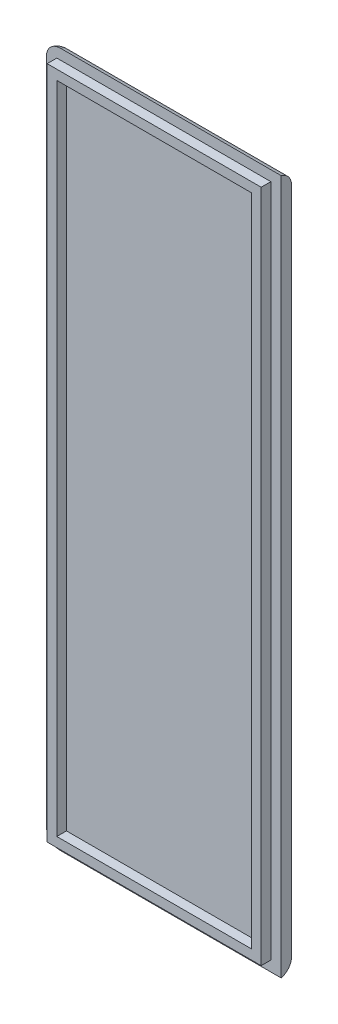
from build123d import *

# Parameters (mm, degrees)
ESQUISSE1_W        = 34
ESQUISSE1_H        = 100.65
BOSS_EXTRU_1_DEPTH = 1.5
ESQUISSE2_W        = 31
ESQUISSE2_H        = 97.65
ESQUISSE2_W_2      = 28.2
ESQUISSE2_H_2      = 94.85
BOSS_EXTRU_2_DEPTH = 1.4
CONG_6_R           = 2
CONG_8_R           = 2
CONG_9_R           = 2


with BuildPart() as part:
    # Esquisse1 → Boss.-Extru.1 (new body)
    with BuildSketch(Plane.XY):
        with Locations((17, 50.325)):
            Rectangle(ESQUISSE1_W, ESQUISSE1_H)
    extrude(amount=BOSS_EXTRU_1_DEPTH)

    # Esquisse2 → Boss.-Extru.2 (add)
    with BuildSketch(Plane.XY.offset(1.5)):
        with Locations((17, 50.325)):
            Rectangle(ESQUISSE2_W, ESQUISSE2_H)
        with Locations((17, 50.325)):
            Rectangle(ESQUISSE2_W_2, ESQUISSE2_H_2, mode=Mode.SUBTRACT)
    extrude(amount=BOSS_EXTRU_2_DEPTH)

    # Congé6
    cong_6_edges = [part.edges().sort_by_distance(p)[0] for p in [
        (0, 0, 0.75),
    ]]
    fillet(cong_6_edges, radius=CONG_6_R)

    # Congé8
    cong_8_edges = [part.edges().sort_by_distance(p)[0] for p in [
        (0, 100.65, 0.75),
    ]]
    fillet(cong_8_edges, radius=CONG_8_R)

    # Congé9
    # the kernel refuses this fillet: 2 mm, written as the material it takes off along each edge
    with BuildSketch(Plane(origin=(38.841229183, 100.65, 0), x_dir=(0, -1, 0), z_dir=(-1, 0, 0)), Plane(origin=(2, 0, 0), x_dir=(0, 1, 0), z_dir=(1, 0, 0))) as cong_9_piece_1:
        with BuildLine():
            CenterArc((1.936491673, 2), CONG_9_R, 194.477512186, 75.522487814)
            Line((0, 1.5), (-0.038729833, 1.49))
            ThreePointArc((-0.038729833, 1.49), (-0.04, 0.75), (-0.04, 0))
            Line((-0.04, 0), (0, -0.04))
            Line((0, -0.04), (1.936491673, -0.04))
            Line((1.936491673, -0.04), (1.936491673, 0))
        make_face()
    extrude(amount=36.841229183, mode=Mode.SUBTRACT)
    with BuildSketch(Plane(origin=(2, 98.65, 0), x_dir=(-1, 0, 0), z_dir=(0, -1, 0))) as cong_9_piece_2:
        with BuildLine():
            CenterArc((0.063508327, -2), CONG_9_R, 14.477512186, 75.522487814)
            Line((2, -1.5), (2.038729833, -1.49))
            ThreePointArc((2.038729833, -1.49), (2.04, -0.75), (2.04, 0))
            Line((2.04, 0), (2, 0.04))
            Line((2, 0.04), (0.063508327, 0.04))
            Line((0.063508327, 0.04), (0.063508327, 0))
        make_face()
    revolve(axis=Axis((2, 98.65, 0), (0, 0, -1)), revolution_arc=90, mode=Mode.SUBTRACT)
    with BuildSketch(Plane(origin=(0, 98.65, 0), x_dir=(1, 0, 0), z_dir=(0, -1, 0))) as cong_9_piece_3:
        with BuildLine():
            CenterArc((1.936491673, 2), CONG_9_R, 194.477512186, 75.522487814)
            Line((0, 1.5), (-0.038729833, 1.49))
            ThreePointArc((-0.038729833, 1.49), (-0.04, 0.75), (-0.04, 0))
            Line((-0.04, 0), (0, -0.04))
            Line((0, -0.04), (1.936491673, -0.04))
            Line((1.936491673, -0.04), (1.936491673, 0))
        make_face()
    extrude(amount=96.65, mode=Mode.SUBTRACT)
    with BuildSketch(Plane(origin=(2, 2, 0), x_dir=(0, -1, 0), z_dir=(1, 0, 0))) as cong_9_piece_4:
        with BuildLine():
            CenterArc((0.063508327, -2), CONG_9_R, 14.477512186, 75.522487814)
            Line((2, -1.5), (2.038729833, -1.49))
            ThreePointArc((2.038729833, -1.49), (2.04, -0.75), (2.04, 0))
            Line((2.04, 0), (2, 0.04))
            Line((2, 0.04), (0.063508327, 0.04))
            Line((0.063508327, 0.04), (0.063508327, 0))
        make_face()
    revolve(axis=Axis((2, 2, 0), (0, 0, -1)), revolution_arc=90, mode=Mode.SUBTRACT)


solid = part.part
